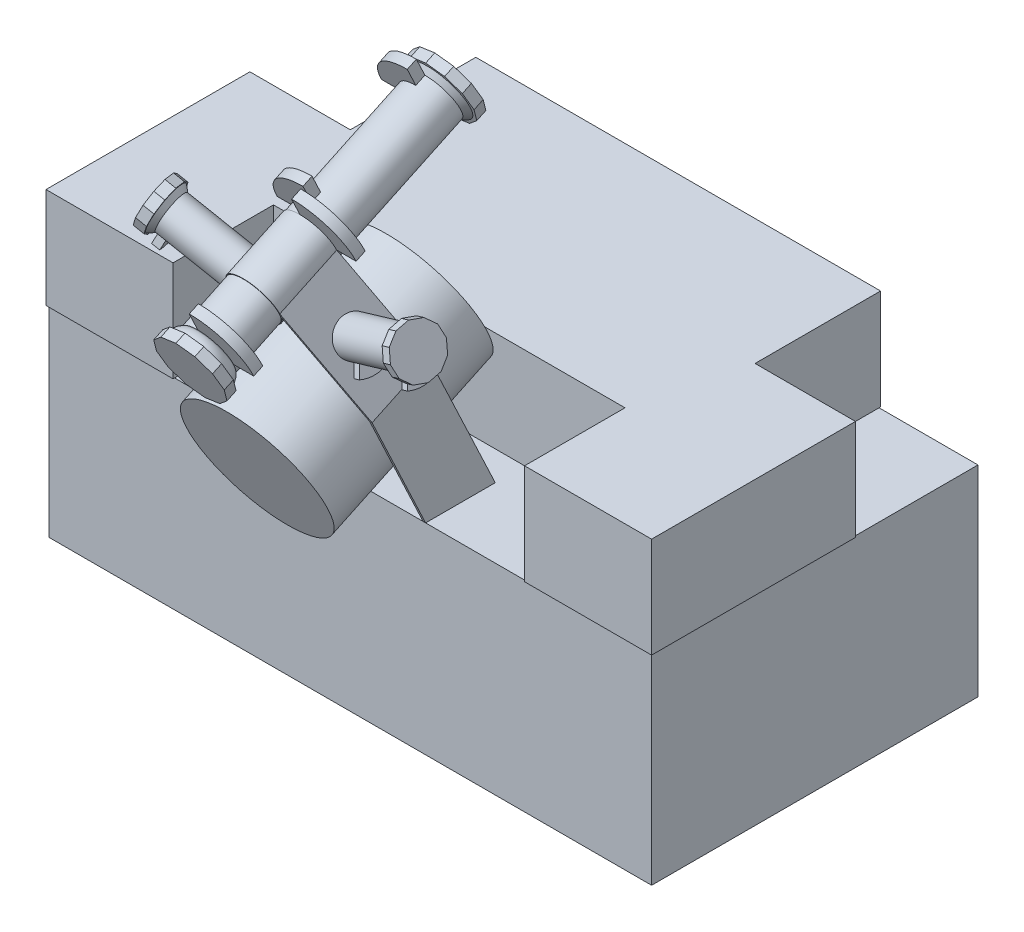
from build123d import *
from build123d.topology import SkipClean

# Parameters (mm, degrees)
SKETCH1_W                 = 120
SKETCH1_H                 = 65
BOSS_EXTRUDE1_DEPTH       = 40
BOSS_EXTRUDE3_DEPTH       = 20
BOSS_EXTRUDE4_DEPTH       = 15
BOSS_EXTRUDE4_DEPTH_BACK  = 15
BOSS_EXTRUDE5_START       = -12.540816
BOSS_EXTRUDE5_DEPTH       = 12.540816
BOSS_EXTRUDE6_DEPTH       = 30
CUT_EXTRUDE1_START        = -12.540815713
CUT_EXTRUDE1_DEPTH        = 12.540815713
SKETCH7_W                 = 29
SKETCH7_H                 = 5.348650585
CUT_EXTRUDE2_DEPTH        = 19.7
BOSS_EXTRUDE7_DEPTH       = 10
BOSS_EXTRUDE7_DEPTH_BACK  = 40
SKETCH8_R                 = 5
SKETCH9_R                 = 6
SKETCH10_R                = 6
BOSS_EXTRUDE8_DEPTH       = 1
FILLET1_R                 = 3
BOSS_EXTRUDE10_DEPTH      = 2
BOSS_EXTRUDE11_DEPTH      = 12
BOSS_EXTRUDE11_DEPTH_BACK = 23
SKETCH14_R                = 14.1
SKETCH15_R                = 3.6
BOSS_EXTRUDE12_DEPTH      = 15
SKETCH16_R                = 4.5
BOSS_EXTRUDE13_DEPTH      = 2
BOSS_EXTRUDE14_DEPTH      = 1.5
BOSS_EXTRUDE15_START      = -1.5
BOSS_EXTRUDE15_DEPTH      = 1.5
BOSS_EXTRUDE17_DEPTH      = 2
SKETCH23_R                = 5
SKETCH20_R                = 6
BOSS_EXTRUDE18_DEPTH      = 2
BOSS_EXTRUDE19_START      = 2
BOSS_EXTRUDE19_DEPTH      = 2
BOSS_EXTRUDE20_START      = 2
BOSS_EXTRUDE20_DEPTH      = 2
BOSS_EXTRUDE21_START      = -2
BOSS_EXTRUDE21_DEPTH      = 2


with BuildPart() as part:
    # Sketch1 → Boss-Extrude1 (new body)
    with BuildSketch(Plane(origin=(0, 0, 0), x_dir=(1, 0, 0), z_dir=(0, 1, 0))):
        Rectangle(SKETCH1_W, SKETCH1_H)
    extrude(amount=BOSS_EXTRUDE1_DEPTH)

    # Sketch2 → Boss-Extrude3 (add)
    with BuildSketch(Plane(origin=(0, 40, 0), x_dir=(1, 0, 0), z_dir=(0, 1, 0))):
        Polygon((-40.3, 32.8), (40.3, 32.8), (40.3, 7.8), (60.3, 7.8), (60.3, -32.8), (35, -32.8), (35, -12.8), (-35, -12.8), (-35, -32.8), (-60.3, -32.8), (-60.3, 7.8), (-40.3, 7.8), align=None)
    extrude(amount=BOSS_EXTRUDE3_DEPTH)

    # Sketch3 → Boss-Extrude4 (add, two sides: drawn at the far end of the back side and taken through both)
    with BuildSketch(Plane.ZY.offset(-BOSS_EXTRUDE4_DEPTH_BACK)):
        Polygon((32.5, 40), (43.162485415, 62.61219593), (29.297383866, 62.61219593), (18.634898451, 40), align=None)
    extrude(amount=BOSS_EXTRUDE4_DEPTH + BOSS_EXTRUDE4_DEPTH_BACK)



with BuildPart() as body_2:
    # Sketch4 → Boss-Extrude5 (new body)
    with BuildSketch(Plane(origin=(0, -5.261244789, 11.157651652), x_dir=(1, 0, 0), z_dir=(0, -0.4264994166141794, 0.9044878371917251)).offset(BOSS_EXTRUDE5_START)):
        with BuildLine():
            Line((-5.144524146, 95.040744528), (-15, 75.040744528))
            Line((-15, 75.040744528), (15, 75.040744528))
            Line((15, 75.040744528), (5.144524146, 95.040744528))
            ThreePointArc((5.144524146, 95.040744528), (0, 100.185268674), (-5.144524146, 95.040744528))
        make_face()
    extrude(amount=BOSS_EXTRUDE5_DEPTH)


with BuildPart() as part_1:
    with SkipClean():  # the faces are left unmerged after this step: merging them gives an invalid solid
        add(part.part)

        add(body_2.part)  # Boss-Extrude6 merges body 2
        # Sketch5 → Boss-Extrude6 (add)
        with BuildSketch(Plane.ZY.offset(15)):
            Polygon((43.162485415, 62.61219593), (31.819470135, 67.960846515), (29.297383866, 62.61219593), align=None)
        extrude(amount=-BOSS_EXTRUDE6_DEPTH)

    # Sketch6 → Cut-Extrude1 (cut)
    with BuildSketch(Plane(origin=(0, -5.261244789, 11.157651652), x_dir=(1, 0, 0), z_dir=(0, -0.4264994166141794, 0.9044878371917253)).offset(CUT_EXTRUDE1_START)):
        with BuildLine():
            Line((-14.5, 50.040744528), (-14.5, 74.945957497))
            Line((-14.5, 74.945957497), (-5.058766347, 94.105323909))
            ThreePointArc((-5.058766347, 94.105323909), (-0.007223255, 89.896225453), (5.056119618, 94.09112192))
            Line((5.056119618, 94.09112192), (14.5, 74.945957497))
            Line((14.5, 74.945957497), (14.5, 50.040744528))
            Line((14.5, 50.040744528), (-14.5, 50.040744528))
        make_face()
    extrude(amount=CUT_EXTRUDE1_DEPTH, mode=Mode.SUBTRACT)

    # Sketch7 → Cut-Extrude2 (cut)
    with BuildSketch(Plane.XY.offset(12.8)):
        with Locations((0, 42.674325293)):
            Rectangle(SKETCH7_W, SKETCH7_H)
    extrude(amount=CUT_EXTRUDE2_DEPTH, mode=Mode.SUBTRACT)

    # Sketch8 → Boss-Extrude7 (add, two sides: drawn at the far end of the back side and taken through both)
    with BuildSketch(Plane(origin=(0, -5.261244789, 11.157651652), x_dir=(1, 0, 0), z_dir=(0, -0.4264994166141794, 0.9044878371917253)).offset(-BOSS_EXTRUDE7_DEPTH_BACK)):
        with Locations(Location((0, 95.040744528, 0), (0, 0, 270))):
            Circle(SKETCH8_R)
    extrude(amount=BOSS_EXTRUDE7_DEPTH + BOSS_EXTRUDE7_DEPTH_BACK)

    # Sketch9 → section 0 of loft1
    with BuildSketch(Plane(origin=(0, -9.952738372, 21.107017861), x_dir=(1, 0, 0), z_dir=(0, -0.4264994166141795, 0.9044878371917251)), mode=Mode.PRIVATE) as loft1_s0:
        with Locations((0, 95.040744528)):
            Circle(SKETCH9_R)
    # loft up to a face of the part (loft1)
    loft([loft1_s0.sketch, Face(Wire([part_1.edges().sort_by_distance((3.644843137, 79.532781164, 62.197146826))[0]]))])

    # Sketch10 → Boss-Extrude8 (add)
    with BuildSketch(Plane(origin=(0, -9.952738372, 21.107017861), x_dir=(1, 0, 0), z_dir=(0, -0.4264994166141794, 0.9044878371917251))):
        with Locations(Location((0, 95.040744528, 0), (0, 0, 270))):
            Circle(SKETCH10_R)
    extrude(amount=BOSS_EXTRUDE8_DEPTH)

    # Fillet1
    # the kernel refuses this fillet: 3 mm, written as the material it takes off along each edge
    with BuildSketch(Plane(origin=(0, 76.010459091, 61.641839957), x_dir=(1, 0, 0), z_dir=(0, 0.9044878371917249, 0.42649941661418017))) as fillet1_piece_1:
        with BuildLine():
            CenterArc((3.010717543, -1.25335823), FILLET1_R, 4.844556223, 40.155443777)
            Line((6, -1), (6.059785649, -0.994932835))
            ThreePointArc((6.059785649, -0.994932835), (6.06, -0.5), (6.06, 0))
            Line((6.06, 0), (6.042426407, 0.042426407))
            Line((6.042426407, 0.042426407), (5.174464294, 0.91038852))
            Line((5.174464294, 0.91038852), (5.132037887, 0.867962113))
        make_face()
    revolve(axis=Axis((0, 76.010459091, 61.641839957), (0, 0.42649941661418017, -0.9044878371917249)), revolution_arc=90, mode=Mode.SUBTRACT)
    with BuildSketch(Plane(origin=(0, 76.010459091, 61.641839957), x_dir=(0, -0.904487837191725, -0.4264994166141795), z_dir=(1, 0, 0))) as fillet1_piece_2:
        with BuildLine():
            CenterArc((3.010717543, -1.25335823), FILLET1_R, 4.844556223, 40.155443777)
            Line((6, -1), (6.059785649, -0.994932835))
            ThreePointArc((6.059785649, -0.994932835), (6.06, -0.5), (6.06, 0))
            Line((6.06, 0), (6.042426407, 0.042426407))
            Line((6.042426407, 0.042426407), (5.174464294, 0.91038852))
            Line((5.174464294, 0.91038852), (5.132037887, 0.867962113))
        make_face()
    revolve(axis=Axis((0, 76.010459091, 61.641839957), (0, 0.42649941661418017, -0.9044878371917249)), revolution_arc=270, mode=Mode.SUBTRACT)

    # Sketch13 → Boss-Extrude10 (add)
    with BuildSketch(Plane(origin=(0, -10.379237789, 22.011505698), x_dir=(1, 0, 0), z_dir=(0, -0.4264994166141794, 0.9044878371917251))):
        Polygon((0, 88.279263744), (3.380740392, 89.185130401), (5.855614126, 91.660004136), (6.761480784, 95.040744528), (5.855614126, 98.42148492), (3.380740392, 100.896358654), (0, 101.802225312), (-3.380740392, 100.896358654), (-5.855614126, 98.42148492), (-6.761480784, 95.040744528), (-5.855614126, 91.660004136), (-3.380740392, 89.185130401), align=None)
    extrude(amount=BOSS_EXTRUDE10_DEPTH)

    # Sketch15 → Boss-Extrude12 (add)
    with BuildSketch(Plane(origin=(41.822517261, 18.640626424, 8.789743729), x_dir=(0.17177226682886385, 0.07768956759545681, -0.9820685411086666), z_dir=(0.897004936364771, 0.39980218825867625, 0.1885214958587147))):
        with Locations(Location((-33.502316865, 63.827172019, 0), (0, 0, 269.940899787))):
            Circle(SKETCH15_R)
    extrude(amount=BOSS_EXTRUDE12_DEPTH)

    # Sketch16 → section 0 of loft2
    with BuildSketch(Plane(origin=(56.174596243, 25.037461436, 11.806087663), x_dir=(0.17177226682886385, 0.07768956759545681, -0.9820685411086666), z_dir=(0.897004936364771, 0.3998021882586762, 0.1885214958587147)), mode=Mode.PRIVATE) as loft2_s0:
        with Locations((-33.502316865, 63.827172019)):
            Circle(SKETCH16_R)
    # loft up to a face of the part (loft2)
    loft([loft2_s0.sketch, part_1.faces().sort_by_distance((23.527336118, 80.328432418, 44.583794379))[0]])

    # Sketch17 → Boss-Extrude13 (add)
    with BuildSketch(Plane(origin=(56.174596243, 25.037461436, 11.806087663), x_dir=(0.1717722668288638, 0.07768956759545687, -0.9820685411086666), z_dir=(0.897004936364771, 0.39980218825867614, 0.18852149585871464))):
        Polygon((-33.502316865, 58.997542888), (-31.087502299, 59.644590501), (-29.319735347, 61.412357454), (-28.672687734, 63.827172019), (-29.319735347, 66.241986585), (-31.087502299, 68.009753538), (-33.502316865, 68.656801151), (-35.917131431, 68.009753538), (-37.684898384, 66.241986585), (-38.331945997, 63.827172019), (-37.684898384, 61.412357454), (-35.917131431, 59.644590501), align=None)
    extrude(amount=BOSS_EXTRUDE13_DEPTH)

    # Sketch18 → Boss-Extrude14 (add)
    with BuildSketch(Plane(origin=(41.822517261, 18.640626424, 8.789743729), x_dir=(0.17219228124684602, 0.07674746041280117, -0.9820690635587666), z_dir=(0.8970049363647709, 0.39980218825867647, 0.18852149585871475))):
        with BuildLine():
            Line((-33.57311806, 63.793909999), (-35.632425653, 58.158375221))
            ThreePointArc((-35.632425653, 58.158375221), (-31.235774814, 58.267896377), (-28.094961197, 61.346503742))
            Line((-28.094961197, 61.346503742), (-33.57311806, 63.793909999))
        make_face()
    extrude(amount=BOSS_EXTRUDE14_DEPTH)

    # Sketch19 → Boss-Extrude15 (add)
    with BuildSketch(Plane(origin=(55.277591307, 24.637659248, 11.617566167), x_dir=(0.17177226682886385, 0.07768956759545681, -0.9820685411086666), z_dir=(0.897004936364771, 0.3998021882586762, 0.1885214958587147)).offset(BOSS_EXTRUDE15_START)):
        with BuildLine():
            Line((-33.507297221, 63.828506501), (-35.572416734, 58.195098883))
            ThreePointArc((-35.572416734, 58.195098883), (-31.175655263, 58.300084866), (-28.031667755, 61.375450865))
            Line((-28.031667755, 61.375450865), (-33.507297221, 63.828506501))
        make_face()
    extrude(amount=BOSS_EXTRUDE15_DEPTH)


with BuildPart() as body_2_2:
    # Sketch14 → Boss-Extrude11 (new, two sides: drawn at the far end of the back side and taken through both)
    with BuildSketch(Plane(origin=(0, -5.261244789, 11.157651652), x_dir=(1, 0, 0), z_dir=(0, -0.4264994166141794, 0.9044878371917253)).offset(-BOSS_EXTRUDE11_DEPTH_BACK)):
        with Locations(Location((0, 68.040744528, 0), (0, 0, 270))):
            Circle(SKETCH14_R)
    extrude(amount=BOSS_EXTRUDE11_DEPTH + BOSS_EXTRUDE11_DEPTH_BACK)


with BuildPart() as body_3:
    # Mirror2: mirrored copy
    add(part_1.part.mirror(Plane(origin=(0, 0, 0), x_dir=(0, 0, 1), z_dir=(1, 0, 0))))


with BuildPart() as part_2:
    add(part_1.part)

    add(body_3.part)  # Boss-Extrude17 merges body 3
    # Sketch22 → Boss-Extrude17 (add)
    with BuildSketch(Plane(origin=(0, 11.798731875, -25.021861836), x_dir=(-1, 0, 0), z_dir=(0, 0.42649941661417945, -0.904487837191725))):
        with BuildLine():
            Line((0, 104.040744528), (0, 95.040744528))
            Line((0, 95.040744528), (9, 95.040744528))
            ThreePointArc((9, 95.040744528), (6.363961031, 101.404705558), (0, 104.040744528))
        make_face()
    extrude(amount=-BOSS_EXTRUDE17_DEPTH)

    # Sketch23 → Loft5 section 0
    with BuildSketch(Plane(origin=(0, 11.798731875, -25.021861836), x_dir=(-1, 0, 0), z_dir=(0, 0.42649941661417945, -0.904487837191725))):
        with Locations((0, 95.040744528)):
            Circle(SKETCH23_R)
    # Sketch20 → Loft5 section 1
    with BuildSketch(Plane(origin=(0, 12.225231292, -25.926349673), x_dir=(-1, 0, 0), z_dir=(0, 0.42649941661417945, -0.904487837191725))):
        with Locations((0, 95.040744528)):
            Circle(SKETCH20_R)
    loft()

    # Sketch24 → Boss-Extrude18 (add)
    with BuildSketch(Plane(origin=(0, 12.225231292, -25.926349673), x_dir=(-1, 0, 0), z_dir=(0, 0.4264994166141796, -0.904487837191725))):
        Polygon((0, 88.279263744), (3.380740392, 89.185130401), (5.855614126, 91.660004136), (6.761480784, 95.040744528), (5.855614126, 98.42148492), (3.380740392, 100.896358654), (0, 101.802225312), (-3.380740392, 100.896358654), (-5.855614126, 98.42148492), (-6.761480784, 95.040744528), (-5.855614126, 91.660004136), (-3.380740392, 89.185130401), align=None)
    extrude(amount=BOSS_EXTRUDE18_DEPTH)

    # Sketch25 → Boss-Extrude19 (add)
    with BuildSketch(Plane(origin=(0, 0.087405796, -0.185363629), x_dir=(-1, 0, 0), z_dir=(0, 0.4264994166141795, -0.9044878371917252)).offset(BOSS_EXTRUDE19_START)):
        with BuildLine():
            Line((0, 104.040744528), (0, 95.040744528))
            Line((0, 95.040744528), (-9, 95.040744528))
            ThreePointArc((-9, 95.040744528), (-6.363961031, 101.404705558), (0, 104.040744528))
        make_face()
    extrude(amount=-BOSS_EXTRUDE19_DEPTH)

    # Sketch26 → Boss-Extrude20 (add)
    with BuildSketch(Plane(origin=(0, 1.153654338, -2.446583222), x_dir=(-1, 0, 0), z_dir=(0, 0.42649941661417956, -0.9044878371917251)).offset(BOSS_EXTRUDE20_START)):
        with BuildLine():
            Line((9, 95.040744528), (0, 95.040744528))
            Line((0, 95.040744528), (0, 104.040744528))
            ThreePointArc((0, 104.040744528), (6.363961031, 101.404705558), (9, 95.040744528))
        make_face()
    extrude(amount=-BOSS_EXTRUDE20_DEPTH)

    # Sketch27 → Boss-Extrude21 (add)
    with BuildSketch(Plane(origin=(0, -9.526238955, 20.202530024), x_dir=(1, 0, 0), z_dir=(0, -0.4264994166141795, 0.9044878371917251)).offset(BOSS_EXTRUDE21_START)):
        with BuildLine():
            Line((0, 95.040744528), (0, 104.040744528))
            ThreePointArc((0, 104.040744528), (6.363961031, 101.404705558), (9, 95.040744528))
            Line((9, 95.040744528), (0, 95.040744528))
        make_face()
    extrude(amount=BOSS_EXTRUDE21_DEPTH)


solid = Compound([body_2_2.part, part_2.part])
